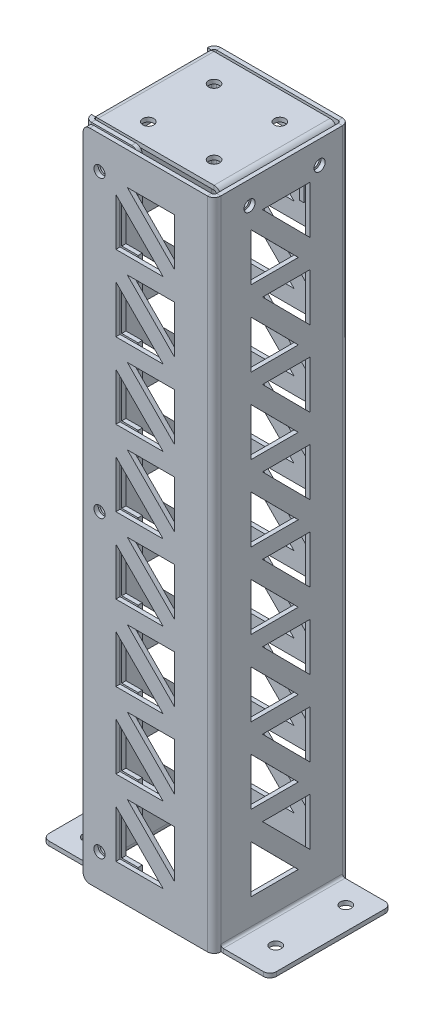
from build123d import *

# Parameters (mm, degrees)
SKETCH2_W                        = 40
SKETCH2_H                        = 200
BASE_FLANGE1_DEPTH               = 1.29
EDGE_FLANGE1_STRIP_W             = 6.684
EDGE_FLANGE1_STRIP_H             = 1.29
EDGE_FLANGE1_STRIP_CUT_DEPTH     = 200
EDGE_FLANGE1_DEPTH               = 200
EDGE_FLANGE2_STRIP_W             = 6.684
EDGE_FLANGE2_STRIP_H             = 1.29
EDGE_FLANGE2_STRIP_CUT_DEPTH     = 200
EDGE_FLANGE2_DEPTH               = 200
EDGE_FLANGE3_STRIP_W             = 6.684
EDGE_FLANGE3_STRIP_H             = 1.29
EDGE_FLANGE3_STRIP_CUT_DEPTH     = 200
EDGE_FLANGE3_DEPTH               = 200
EDGE_FLANGE4_STRIP_W             = 6.684
EDGE_FLANGE4_STRIP_H             = 1.29
EDGE_FLANGE4_STRIP_CUT_DEPTH     = 200
EDGE_FLANGE4_DEPTH               = 200
EDGE_FLANGE5_STRIP_W             = 6.684
EDGE_FLANGE5_STRIP_H             = 1.29
EDGE_FLANGE5_STRIP_CUT_DEPTH     = 37.186
EDGE_FLANGE5_DEPTH               = 37.186
EDGE_FLANGE6_STRIP_W             = 6.684
EDGE_FLANGE6_STRIP_H             = 1.29
EDGE_FLANGE6_STRIP_CUT_DEPTH     = 35.396
EDGE_FLANGE6_DEPTH               = 35.396
EDGE_FLANGE8_STRIP_W             = 6.684
EDGE_FLANGE8_STRIP_H             = 1.29
EDGE_FLANGE8_STRIP_CUT_DEPTH     = 35.396
EDGE_FLANGE8_DEPTH               = 35.396
EDGE_FLANGE9_START               = -39.238
EDGE_FLANGE9_DEPTH               = 35.396
EDGE_FLANGE9_2_DEPTH             = 35.396
SPEED_HOLE_DEPTH                 = 212.494359499
SPEED_HOLES_COUNT                = 8
SPEED_HOLES_PITCH                = 23.13
COPY_OF_SPEED_HOLES_COUNT        = 2
COPY_OF_SPEED_HOLES_ANGLE        = 90
COPY_OF_SPEED_HOLES_COPY_1_DEPTH = 212.494359499
COPY_OF_SPEED_HOLES_COPY_2_DEPTH = 212.494359499
COPY_OF_SPEED_HOLES_COPY_3_DEPTH = 212.494359499
COPY_OF_SPEED_HOLES_COPY_4_DEPTH = 212.494359499
COPY_OF_SPEED_HOLES_COPY_5_DEPTH = 212.494359499
COPY_OF_SPEED_HOLES_COPY_6_DEPTH = 212.494359499
COPY_OF_SPEED_HOLES_COPY_7_DEPTH = 212.494359499
M3_CLEARANCE_HOLE1_AT_2_COUNT    = 2
M3_CLEARANCE_HOLE1_AT_2_PITCH    = 21.396
M3_CLEARANCE_HOLE2_D             = 3.4
M3_START                         = -3.08
M3_CLEARANCE_HOLE3_OUTLINE_R     = 1.7
M3_CLEARANCE_HOLE3_DEPTH         = 3.08
M3_START_2                       = 36.92
M3_CLEARANCE_HOLE4_OUTLINE_R     = 1.7
M3_CLEARANCE_HOLE4_DEPTH         = 3.08
FILLET1_R                        = 2


# Read off the part's stored shape, not the designer's step: Edge-Flange9, M3 Clearance Hole3, M3 Clearance Hole4
# Sheet-metal steps are written as plain solids
with BuildPart() as part:
    # Sketch2 → Base-Flange1 (new body)
    with BuildSketch(Plane.XY):
        with Locations((20, 100)):
            Rectangle(SKETCH2_W, SKETCH2_H)
    extrude(amount=-BASE_FLANGE1_DEPTH)

    # Edge-Flange1 strip (across the edge) → Edge-Flange1 strip cut (cut)
    with BuildSketch(Plane(origin=(40, 200, -1.29), x_dir=(-1, 0, 0), z_dir=(0, -1, 0))):
        with Locations((-1.29, -0.645)):
            Rectangle(EDGE_FLANGE1_STRIP_W, EDGE_FLANGE1_STRIP_H)
    extrude(amount=EDGE_FLANGE1_STRIP_CUT_DEPTH, mode=Mode.SUBTRACT)

    # Edge-Flange1 section (across the edge) → Edge-Flange1 (add)
    with BuildSketch(Plane(origin=(40, 200, -1.29), x_dir=(-1, 0, 0), z_dir=(0, -1, 0))):
        with BuildLine():
            Line((0, 0.762), (0, 40))
            Line((0, 40), (1.29, 40))
            Line((1.29, 40), (1.29, 0.762))
            ThreePointArc((1.29, 0.762), (1.513184633, 0.223184633), (2.052, 0))
            Line((2.052, 0), (2.052, -1.29))
            ThreePointArc((2.052, -1.29), (0.601016885, -0.688983115), (0, 0.762))
        make_face()
    extrude(amount=EDGE_FLANGE1_DEPTH)

    # Edge-Flange2 strip (across the edge) → Edge-Flange2 strip cut (cut)
    with BuildSketch(Plane(origin=(38.71, 200, -41.29), x_dir=(0, 0, 1), z_dir=(0, -1, 0))):
        with Locations((-1.29, -0.645)):
            Rectangle(EDGE_FLANGE2_STRIP_W, EDGE_FLANGE2_STRIP_H)
    extrude(amount=EDGE_FLANGE2_STRIP_CUT_DEPTH, mode=Mode.SUBTRACT)

    # Edge-Flange2 section (across the edge) → Edge-Flange2 (add)
    with BuildSketch(Plane(origin=(38.71, 200, -41.29), x_dir=(0, 0, 1), z_dir=(0, -1, 0))):
        with BuildLine():
            Line((0, 0.762), (0, 40))
            Line((0, 40), (1.29, 40))
            Line((1.29, 40), (1.29, 0.762))
            ThreePointArc((1.29, 0.762), (1.513184633, 0.223184633), (2.052, 0))
            Line((2.052, 0), (2.052, -1.29))
            ThreePointArc((2.052, -1.29), (0.601016885, -0.688983115), (0, 0.762))
        make_face()
    extrude(amount=EDGE_FLANGE2_DEPTH)

    # Edge-Flange3 strip (across the edge) → Edge-Flange3 strip cut (cut)
    with BuildSketch(Plane(origin=(-1.29, 200, -40), x_dir=(1, 0, 0), z_dir=(0, -1, 0))):
        with Locations((-1.29, -0.645)):
            Rectangle(EDGE_FLANGE3_STRIP_W, EDGE_FLANGE3_STRIP_H)
    extrude(amount=EDGE_FLANGE3_STRIP_CUT_DEPTH, mode=Mode.SUBTRACT)

    # Edge-Flange3 section (across the edge) → Edge-Flange3 (add)
    with BuildSketch(Plane(origin=(-1.29, 200, -40), x_dir=(1, 0, 0), z_dir=(0, -1, 0))):
        with BuildLine():
            Line((0, 0.762), (0, 38.21))
            Line((0, 38.21), (1.29, 38.21))
            Line((1.29, 38.21), (1.29, 0.762))
            ThreePointArc((1.29, 0.762), (1.513184633, 0.223184633), (2.052, 0))
            Line((2.052, 0), (2.052, -1.29))
            ThreePointArc((2.052, -1.29), (0.601016885, -0.688983115), (0, 0.762))
        make_face()
    extrude(amount=EDGE_FLANGE3_DEPTH)

    # Edge-Flange4 strip (across the edge) → Edge-Flange4 strip cut (cut)
    with BuildSketch(Plane(origin=(0, 200, -1.79), x_dir=(0, 0, -1), z_dir=(0, -1, 0))):
        with Locations((-1.29, -0.645)):
            Rectangle(EDGE_FLANGE4_STRIP_W, EDGE_FLANGE4_STRIP_H)
    extrude(amount=EDGE_FLANGE4_STRIP_CUT_DEPTH, mode=Mode.SUBTRACT)

    # Edge-Flange4 section (across the edge) → Edge-Flange4 (add)
    with BuildSketch(Plane(origin=(0, 200, -1.79), x_dir=(0, 0, -1), z_dir=(0, -1, 0))):
        with BuildLine():
            Line((0, 0.762), (0, 15))
            Line((0, 15), (1.29, 15))
            Line((1.29, 15), (1.29, 0.762))
            ThreePointArc((1.29, 0.762), (1.513184633, 0.223184633), (2.052, 0))
            Line((2.052, 0), (2.052, -1.29))
            ThreePointArc((2.052, -1.29), (0.601016885, -0.688983115), (0, 0.762))
        make_face()
    extrude(amount=EDGE_FLANGE4_DEPTH)

    # Edge-Flange5 strip (across the edge) → Edge-Flange5 strip cut (cut)
    with BuildSketch(Plane(origin=(40, 0, -2.052), x_dir=(0, 1, 0), z_dir=(0, 0, -1))):
        with Locations((-1.29, -0.645)):
            Rectangle(EDGE_FLANGE5_STRIP_W, EDGE_FLANGE5_STRIP_H)
    extrude(amount=EDGE_FLANGE5_STRIP_CUT_DEPTH, mode=Mode.SUBTRACT)

    # Edge-Flange5 section (across the edge) → Edge-Flange5 (add)
    with BuildSketch(Plane(origin=(40, 0, -2.052), x_dir=(0, 1, 0), z_dir=(0, 0, -1))):
        with BuildLine():
            Line((0, 0.762), (0, 15))
            Line((0, 15), (1.29, 15))
            Line((1.29, 15), (1.29, 0.762))
            ThreePointArc((1.29, 0.762), (1.513184633, 0.223184633), (2.052, 0))
            Line((2.052, 0), (2.052, -1.29))
            ThreePointArc((2.052, -1.29), (0.601016885, -0.688983115), (0, 0.762))
        make_face()
    extrude(amount=EDGE_FLANGE5_DEPTH)

    # Edge-Flange6 strip (across the edge) → Edge-Flange6 strip cut (cut)
    with BuildSketch(Plane(origin=(-1.29, 0, -39.238), x_dir=(0, 1, 0), z_dir=(0, 0, 1))):
        with Locations((-1.29, -0.645)):
            Rectangle(EDGE_FLANGE6_STRIP_W, EDGE_FLANGE6_STRIP_H)
    extrude(amount=EDGE_FLANGE6_STRIP_CUT_DEPTH, mode=Mode.SUBTRACT)

    # Edge-Flange6 section (across the edge) → Edge-Flange6 (add)
    with BuildSketch(Plane(origin=(-1.29, 0, -39.238), x_dir=(0, 1, 0), z_dir=(0, 0, 1))):
        with BuildLine():
            Line((0, 0.762), (0, 15))
            Line((0, 15), (1.29, 15))
            Line((1.29, 15), (1.29, 0.762))
            ThreePointArc((1.29, 0.762), (1.513184633, 0.223184633), (2.052, 0))
            Line((2.052, 0), (2.052, -1.29))
            ThreePointArc((2.052, -1.29), (0.601016885, -0.688983115), (0, 0.762))
        make_face()
    extrude(amount=EDGE_FLANGE6_DEPTH)

    # Edge-Flange8 strip (across the edge) → Edge-Flange8 strip cut (cut)
    with BuildSketch(Plane(origin=(0, 200, -39.238), x_dir=(0, -1, 0), z_dir=(0, 0, 1))):
        with Locations((-1.29, -0.645)):
            Rectangle(EDGE_FLANGE8_STRIP_W, EDGE_FLANGE8_STRIP_H)
    extrude(amount=EDGE_FLANGE8_STRIP_CUT_DEPTH, mode=Mode.SUBTRACT)

    # Edge-Flange8 section (across the edge) → Edge-Flange8 (add)
    with BuildSketch(Plane(origin=(0, 200, -39.238), x_dir=(0, -1, 0), z_dir=(0, 0, 1))):
        with BuildLine():
            Line((0, 0.762), (0, 38.21))
            Line((0, 38.21), (1.29, 38.21))
            Line((1.29, 38.21), (1.29, 0.762))
            ThreePointArc((1.29, 0.762), (1.513184633, 0.223184633), (2.052, 0))
            Line((2.052, 0), (2.052, -1.29))
            ThreePointArc((2.052, -1.29), (0.601016885, -0.688983115), (0, 0.762))
        make_face()
    extrude(amount=EDGE_FLANGE8_DEPTH)

    # Edge-Flange9 outline → Edge-Flange9 (cut)
    with BuildSketch(Plane.XY.offset(EDGE_FLANGE9_START)):
        with BuildLine():
            ThreePointArc((36.158, 200), (37.308452085, 199.647165678), (38.063271634, 198.71))
            Line((38.063271634, 198.71), (38.21, 198.71))
            Line((38.21, 198.71), (38.21, 200))
            Line((38.21, 200), (36.158, 200))
        make_face()
    extrude(amount=EDGE_FLANGE9_DEPTH, mode=Mode.SUBTRACT)

    # Edge-Flange9 2 outline → Edge-Flange9 2 (add)
    with BuildSketch(Plane.XY.offset(EDGE_FLANGE9_START)):
        with BuildLine():
            Line((38.21, 183.71), (38.21, 197.948))
            ThreePointArc((38.21, 197.948), (38.172984044, 198.335999102), (38.063271634, 198.71))
            Line((38.063271634, 198.71), (36.158, 198.71))
            ThreePointArc((36.158, 198.71), (36.696815367, 198.486815367), (36.92, 197.948))
            Line((36.92, 197.948), (36.92, 183.71))
            Line((36.92, 183.71), (38.21, 183.71))
        make_face()
    extrude(amount=EDGE_FLANGE9_2_DEPTH)

    # Sketch37 → Speed Hole (cut, through all)
    with BuildSketch(Plane.XY):
        Polygon((27.948, 190), (13.502894177, 190), (27.948, 175.443477769), align=None)
        Polygon((24.445105823, 171.875), (10, 186.431522231), (10, 171.875), align=None)
    speed_hole = extrude(amount=-SPEED_HOLE_DEPTH, mode=Mode.SUBTRACT)

    # Speed Holes: Speed Hole ×8
    with Locations(*[(0, -i * SPEED_HOLES_PITCH, 0) for i in range(1, SPEED_HOLES_COUNT)]):
        add(speed_hole, mode=Mode.SUBTRACT)

    # Copy of Speed Holes: Speed Hole ×2 about axis
    copy_of_speed_holes_axis = Axis((19.355, -7.8454, -20.645), (0, 1, 0))
    for i in range(1, COPY_OF_SPEED_HOLES_COUNT):
        add(speed_hole.rotate(copy_of_speed_holes_axis, i * COPY_OF_SPEED_HOLES_ANGLE / (COPY_OF_SPEED_HOLES_COUNT - 1)), mode=Mode.SUBTRACT)

    # Copy of Speed Holes copy 1 sketch → Copy of Speed Holes copy 1 (cut, through all)
    with BuildSketch(Plane(origin=(40, -23.13, -1.29), x_dir=(0, 0, -1), z_dir=(1, 0, 0))):
        Polygon((27.948, 190), (13.502894177, 190), (27.948, 175.443477769), align=None)
        Polygon((24.445105823, 171.875), (10, 186.431522231), (10, 171.875), align=None)
    extrude(amount=-COPY_OF_SPEED_HOLES_COPY_1_DEPTH, mode=Mode.SUBTRACT)

    # Copy of Speed Holes copy 2 sketch → Copy of Speed Holes copy 2 (cut, through all)
    with BuildSketch(Plane(origin=(40, -46.26, -1.29), x_dir=(0, 0, -1), z_dir=(1, 0, 0))):
        Polygon((27.948, 190), (13.502894177, 190), (27.948, 175.443477769), align=None)
        Polygon((24.445105823, 171.875), (10, 186.431522231), (10, 171.875), align=None)
    extrude(amount=-COPY_OF_SPEED_HOLES_COPY_2_DEPTH, mode=Mode.SUBTRACT)

    # Copy of Speed Holes copy 3 sketch → Copy of Speed Holes copy 3 (cut, through all)
    with BuildSketch(Plane(origin=(40, -69.39, -1.29), x_dir=(0, 0, -1), z_dir=(1, 0, 0))):
        Polygon((27.948, 190), (13.502894177, 190), (27.948, 175.443477769), align=None)
        Polygon((24.445105823, 171.875), (10, 186.431522231), (10, 171.875), align=None)
    extrude(amount=-COPY_OF_SPEED_HOLES_COPY_3_DEPTH, mode=Mode.SUBTRACT)

    # Copy of Speed Holes copy 4 sketch → Copy of Speed Holes copy 4 (cut, through all)
    with BuildSketch(Plane(origin=(40, -92.52, -1.29), x_dir=(0, 0, -1), z_dir=(1, 0, 0))):
        Polygon((27.948, 190), (13.502894177, 190), (27.948, 175.443477769), align=None)
        Polygon((24.445105823, 171.875), (10, 186.431522231), (10, 171.875), align=None)
    extrude(amount=-COPY_OF_SPEED_HOLES_COPY_4_DEPTH, mode=Mode.SUBTRACT)

    # Copy of Speed Holes copy 5 sketch → Copy of Speed Holes copy 5 (cut, through all)
    with BuildSketch(Plane(origin=(40, -115.65, -1.29), x_dir=(0, 0, -1), z_dir=(1, 0, 0))):
        Polygon((27.948, 190), (13.502894177, 190), (27.948, 175.443477769), align=None)
        Polygon((24.445105823, 171.875), (10, 186.431522231), (10, 171.875), align=None)
    extrude(amount=-COPY_OF_SPEED_HOLES_COPY_5_DEPTH, mode=Mode.SUBTRACT)

    # Copy of Speed Holes copy 6 sketch → Copy of Speed Holes copy 6 (cut, through all)
    with BuildSketch(Plane(origin=(40, -138.78, -1.29), x_dir=(0, 0, -1), z_dir=(1, 0, 0))):
        Polygon((27.948, 190), (13.502894177, 190), (27.948, 175.443477769), align=None)
        Polygon((24.445105823, 171.875), (10, 186.431522231), (10, 171.875), align=None)
    extrude(amount=-COPY_OF_SPEED_HOLES_COPY_6_DEPTH, mode=Mode.SUBTRACT)

    # Copy of Speed Holes copy 7 sketch → Copy of Speed Holes copy 7 (cut, through all)
    with BuildSketch(Plane(origin=(40, -161.91, -1.29), x_dir=(0, 0, -1), z_dir=(1, 0, 0))):
        Polygon((27.948, 190), (13.502894177, 190), (27.948, 175.443477769), align=None)
        Polygon((24.445105823, 171.875), (10, 186.431522231), (10, 171.875), align=None)
    extrude(amount=-COPY_OF_SPEED_HOLES_COPY_7_DEPTH, mode=Mode.SUBTRACT)

    # Sketch39 → M3 Clearance Hole1 (revolve, cut)
    with BuildSketch(Plane(origin=(-9.29, 1.29, -32.238), x_dir=(0, 0, 1), z_dir=(1, 0, 0))):
        Polygon((0, 0), (0, 13.021463052), (1.7, 12), (1.7, 0), align=None)
    m3_clearance_hole1 = revolve(axis=Axis((-9.29, 7.64, -32.238), (0, -1, 0)), mode=Mode.SUBTRACT)

    # M3 Clearance Hole1 at 2: M3 Clearance Hole1 ×2
    with Locations(*[(0, 0, i * M3_CLEARANCE_HOLE1_AT_2_PITCH) for i in range(1, M3_CLEARANCE_HOLE1_AT_2_COUNT)]):
        add(m3_clearance_hole1, mode=Mode.SUBTRACT)

    # Copy of M3 Hole1: M3 Clearance Hole1 across plane
    add(m3_clearance_hole1.mirror(Plane.ZY.offset(-19.355)), mode=Mode.SUBTRACT)

    # Copy of M3 Hole1 copy 1 sketch → Copy of M3 Hole1 copy 1 (revolve, cut)
    with BuildSketch(Plane(origin=(48, 1.29, -10.842), x_dir=(0, 0, 1), z_dir=(-1, 0, 0))):
        Polygon((0, 0), (0, -13.021463052), (1.7, -12), (1.7, 0), align=None)
    revolve(axis=Axis((48, 7.64, -10.842), (0, 1, 0)), mode=Mode.SUBTRACT)

    # M3 Clearance Hole2 (through all)
    with Locations(Plane(origin=(0, 200, 0), x_dir=(1, 0, 0), z_dir=(0, 1, 0))):
        with Locations((9.311016885, 30.688983115), (29.398983115, 30.688983115), (29.398983115, 10.601016885), (9.311016885, 10.601016885)):
            Hole(M3_CLEARANCE_HOLE2_D / 2)

    # M3 Clearance Hole3 outline → M3 Clearance Hole3 (cut)
    with BuildSketch(Plane.XY.offset(M3_START)):
        with Locations((5, 100)):
            Circle(M3_CLEARANCE_HOLE3_OUTLINE_R)
        with Locations((5, 10)):
            Circle(M3_CLEARANCE_HOLE3_OUTLINE_R)
        with Locations((5, 190)):
            Circle(M3_CLEARANCE_HOLE3_OUTLINE_R)
    extrude(amount=M3_CLEARANCE_HOLE3_DEPTH, mode=Mode.SUBTRACT)

    # M3 Clearance Hole4 outline → M3 Clearance Hole4 (cut)
    with BuildSketch(Plane.YZ.offset(M3_START_2)):
        with Locations((193, -32.238)):
            Circle(M3_CLEARANCE_HOLE4_OUTLINE_R)
        with Locations((193, -10.842)):
            Circle(M3_CLEARANCE_HOLE4_OUTLINE_R)
    extrude(amount=M3_CLEARANCE_HOLE4_DEPTH, mode=Mode.SUBTRACT)

    # Fillet1
    fillet1_edges = [part.edges().sort_by_distance(p)[0] for p in [
        (15, 200, -2.435),
        (15, 0, -2.435),
        (55, 0.645, -2.052),
        (55, 0.645, -39.238),
        (-16.29, 0.645, -39.238),
        (-16.29, 0.645, -3.842),
        (37.565, 183.71, -39.238),
        (37.565, 183.71, -3.842),
        (0, 200, -0.645),
        (0, 0, -0.645),
    ]]
    fillet(fillet1_edges, radius=FILLET1_R)


solid = part.part
